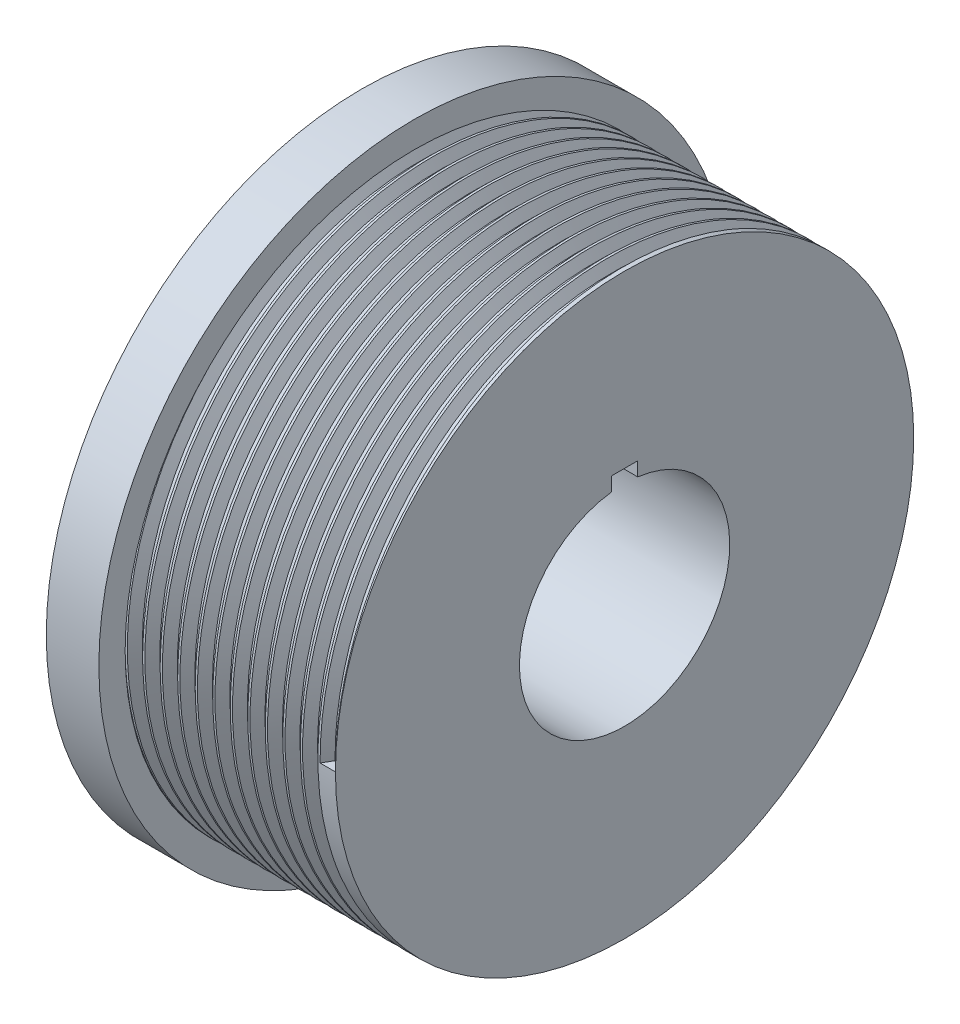
from build123d import *

# Parameters (mm, degrees)
SKETCH1_R           = 19.05
SKETCH1_R_2         = 17.4625
BOSS_EXTRUDE1_DEPTH = 3.175
SKETCH1_2_R         = 17.4625
BOSS_EXTRUDE2_DEPTH = 15.875
THREAD1_PITCH       = 1.058333333


with BuildPart() as part:
    # Sketch1 → Boss-Extrude1 (new body)
    with BuildSketch(Plane(origin=(0, 0, 0), x_dir=(0, 0, -1), z_dir=(1, 0, 0))):
        Circle(SKETCH1_R)
        Circle(SKETCH1_R_2, mode=Mode.SUBTRACT)
    extrude(amount=BOSS_EXTRUDE1_DEPTH)

    # Sketch1<2> → Boss-Extrude2 (add)
    with BuildSketch(Plane(origin=(0, 0, 0), x_dir=(0, 0, -1), z_dir=(1, 0, 0))):
        Circle(SKETCH1_2_R)
        with BuildLine():
            Line((-0.79375, 6.300195309), (-0.79375, 7.14375))
            Line((-0.79375, 7.14375), (0.79375, 7.14375))
            Line((0.79375, 7.14375), (0.79375, 6.300195309))
            ThreePointArc((0.79375, 6.300195309), (0, -6.35), (-0.79375, 6.300195309))
        make_face(mode=Mode.SUBTRACT)
    extrude(amount=BOSS_EXTRUDE2_DEPTH)

    # Thread1: the profile of Thread Profile1 profile screwed along a right-hand helix of 12 turns, 8 arcs to a turn; built about Z, then put on its axis
    thread1_z = Axis((0, 0, 0), (0, 0, 1))
    thread1_corners = [(17.4628, 0, -0.000173205), (17.4628, 0, 0.926214869), (16.889660282, 0, 0.595312499), (16.889660282, 0, 0.330729165)]
    with BuildLine(mode=Mode.PRIVATE) as thread1_profile:
        Line(thread1_corners[0], thread1_corners[1])
        Line(thread1_corners[1], thread1_corners[2])
        Line(thread1_corners[2], thread1_corners[3])
        Line(thread1_corners[3], thread1_corners[0])
    thread1_cap = Face(thread1_profile.wire())
    thread1_turn_angles = [0, 22.5, 45, 67.5, 90, 112.5, 135, 157.5, 180, 202.5, 225, 247.5, 270, 292.5, 315, 337.5, 360]
    thread1_turn_weights = [1, 0.9238795325112867, 1, 0.9238795325112867, 1, 0.9238795325112867, 1, 0.9238795325112867, 1, 0.9238795325112867, 1, 0.9238795325112867, 1, 0.9238795325112867, 1, 0.9238795325112867, 1]
    thread1_turn_rails = [Edge.make_bspline([Vector(p[0], p[1], 0).rotate(thread1_z, thread1_turn_angles[k]) / thread1_turn_weights[k] + Vector(0, 0, p[2] + THREAD1_PITCH * thread1_turn_angles[k] / 360) for k in range(17)], [0, 0, 0, 1, 1, 2, 2, 3, 3, 4, 4, 5, 5, 6, 6, 7, 7, 8, 8, 8], 2, thread1_turn_weights) for p in thread1_corners]
    thread1_turn_sides = [Face.make_surface_from_curves(thread1_turn_rails[p[0]], thread1_turn_rails[p[1]]) for p in [(0, 1), (1, 2), (2, 3), (3, 0)]]
    thread1 = Plane(origin=(15.875, 0, 0), x_dir=(0, 0, 1), z_dir=(-1, 0, 0)) * Solid(Shell([*[p.moved(Location((0, 0, THREAD1_PITCH * i))) for i in range(12) for p in thread1_turn_sides], thread1_cap, thread1_cap.rotate(thread1_z, 4320).moved(Location((0, 0, THREAD1_PITCH * 4320 / 360)))]))
    add(thread1, mode=Mode.SUBTRACT)


solid = part.part
